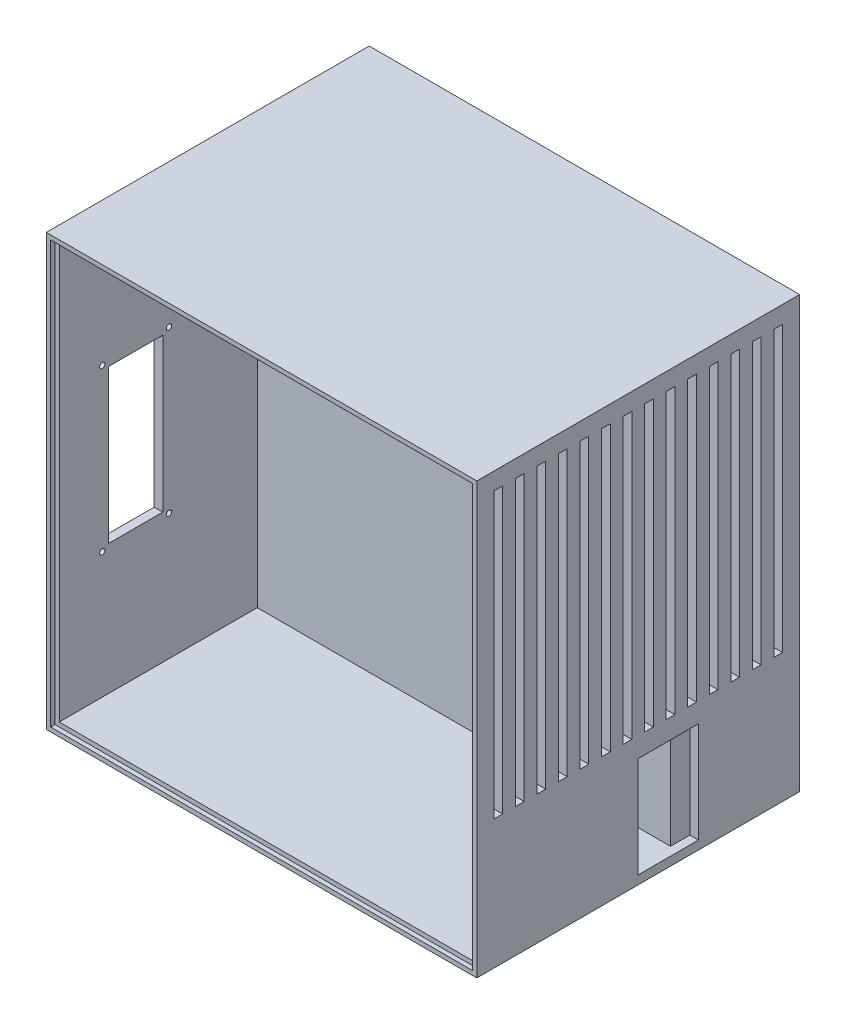
from build123d import *

# Parameters (mm, degrees)
SKETCH4_W                = 200
SKETCH4_H                = 200
BOSS_EXTRUDE1_DEPTH      = 150
SKETCH6_W                = 196
SKETCH6_H                = 196
CUT_EXTRUDE1_DEPTH       = 2
SKETCH7_W                = 192
SKETCH7_H                = 192
CUT_EXTRUDE2_DEPTH       = 92
SKETCH9_W                = 28
SKETCH9_H                = 46.8
INLET_DEPTH              = 4
SKETCH13_W               = 4
SKETCH13_H               = 132
AIRFLOW_DEPTH            = 4
SKETCH11_W               = 25.2
SKETCH11_H               = 71.2
CUT_EXTRUDE5_DEPTH       = 4
SKETCH11_4_R             = 1.25
LCD_MOUNTING_DEPTH       = 4
SKETCH12_R               = 0.55
SKETCH12_R_2             = 1
POST_KNOB_MOUNTING_DEPTH = 4


with BuildPart() as part:
    # Sketch4 → Boss-Extrude1 (new body)
    with BuildSketch(Plane.XY):
        with Locations((100, 100)):
            Rectangle(SKETCH4_W, SKETCH4_H)
    extrude(amount=BOSS_EXTRUDE1_DEPTH)

    # Sketch6 → Cut-Extrude1 (cut)
    with BuildSketch(Plane.XY.offset(150)):
        with Locations((100, 100)):
            Rectangle(SKETCH6_W, SKETCH6_H)
    extrude(amount=-CUT_EXTRUDE1_DEPTH, mode=Mode.SUBTRACT)

    # Sketch7 → Cut-Extrude2 (cut)
    with BuildSketch(Plane.XY.offset(148)):
        with Locations((100, 100)):
            Rectangle(SKETCH7_W, SKETCH7_H)
    extrude(amount=-CUT_EXTRUDE2_DEPTH, mode=Mode.SUBTRACT)

    # Sketch9 → Inlet (cut)
    with BuildSketch(Plane(origin=(200, 0, 0), x_dir=(0, 0, -1), z_dir=(1, 0, 0))):
        with Locations((-61, 27.4)):
            Rectangle(SKETCH9_W, SKETCH9_H)
    extrude(amount=-INLET_DEPTH, mode=Mode.SUBTRACT)

    # Sketch13 → Airflow (cut)
    with BuildSketch(Plane(origin=(200, 0, 0), x_dir=(0, 0, -1), z_dir=(1, 0, 0))):
        with Locations((-10, 126)):
            Rectangle(SKETCH13_W, SKETCH13_H)
        with Locations((-20, 126)):
            Rectangle(SKETCH13_W, SKETCH13_H)
        with Locations((-30, 126)):
            Rectangle(SKETCH13_W, SKETCH13_H)
        with Locations((-40, 126)):
            Rectangle(SKETCH13_W, SKETCH13_H)
        with Locations((-50, 126)):
            Rectangle(SKETCH13_W, SKETCH13_H)
        with Locations((-60, 126)):
            Rectangle(SKETCH13_W, SKETCH13_H)
        with Locations((-70, 126)):
            Rectangle(SKETCH13_W, SKETCH13_H)
        with Locations((-80, 126)):
            Rectangle(SKETCH13_W, SKETCH13_H)
        with Locations((-90, 126)):
            Rectangle(SKETCH13_W, SKETCH13_H)
        with Locations((-100, 126)):
            Rectangle(SKETCH13_W, SKETCH13_H)
        with Locations((-110, 126)):
            Rectangle(SKETCH13_W, SKETCH13_H)
        with Locations((-120, 126)):
            Rectangle(SKETCH13_W, SKETCH13_H)
        with Locations((-130, 126)):
            Rectangle(SKETCH13_W, SKETCH13_H)
        with Locations((-140, 126)):
            Rectangle(SKETCH13_W, SKETCH13_H)
    extrude(amount=-AIRFLOW_DEPTH, mode=Mode.SUBTRACT)

    # Sketch11 → Cut-Extrude5 (cut)
    with BuildSketch(Plane.ZY):
        with Locations((112.5, 100)):
            Rectangle(SKETCH11_W, SKETCH11_H)
    extrude(amount=-CUT_EXTRUDE5_DEPTH, mode=Mode.SUBTRACT)

    # Sketch11<4> → LCD/Mounting (cut)
    with BuildSketch(Plane.ZY):
        with Locations((128, 137.5)):
            Circle(SKETCH11_4_R)
        with Locations((97, 137.5)):
            Circle(SKETCH11_4_R)
        with Locations((97, 62.5)):
            Circle(SKETCH11_4_R)
        with Locations((128, 62.5)):
            Circle(SKETCH11_4_R)
    extrude(amount=-LCD_MOUNTING_DEPTH, mode=Mode.SUBTRACT)

    # Sketch12 → Post/Knob Mounting (cut)
    with BuildSketch(Plane.ZY):
        with Locations((37.5, 100)):
            Circle(SKETCH12_R)
        with Locations((37.5, 80)):
            Circle(SKETCH12_R)
        with Locations((37.5, 60)):
            Circle(SKETCH12_R)
        with Locations((37.5, 148)):
            Circle(SKETCH12_R_2)
    extrude(amount=-POST_KNOB_MOUNTING_DEPTH, mode=Mode.SUBTRACT)


solid = part.part
